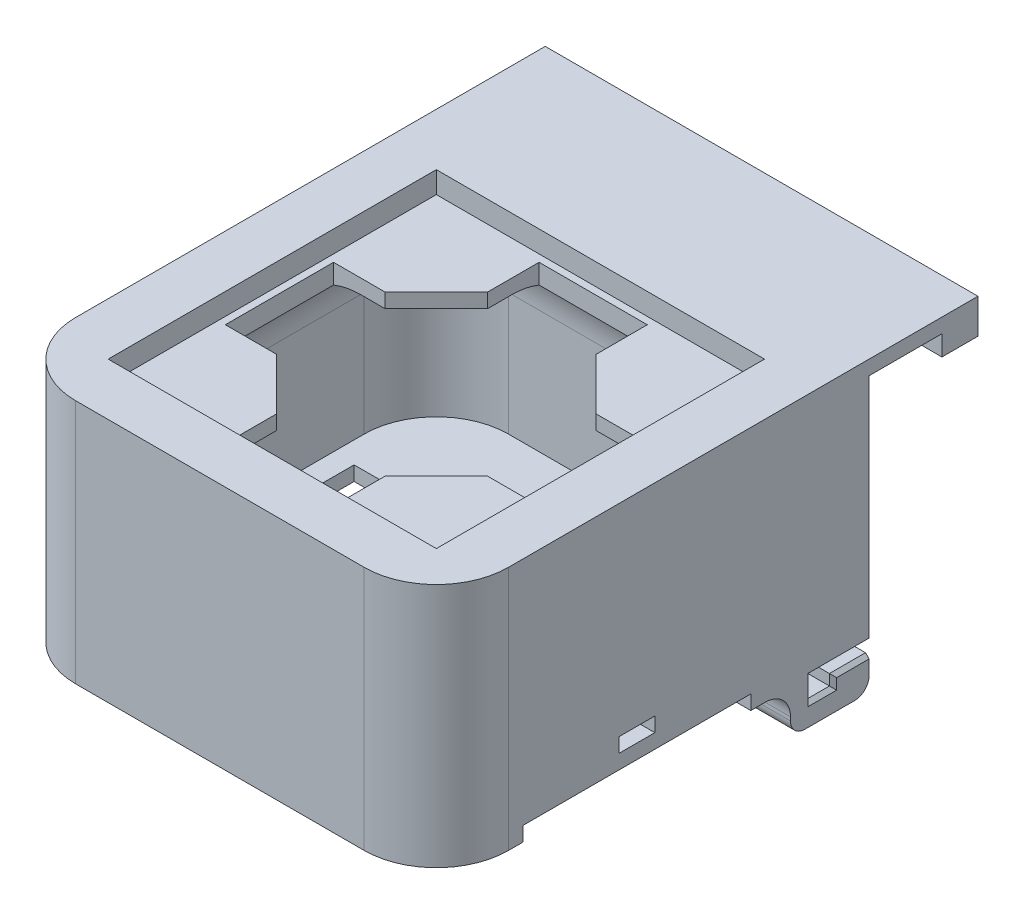
from build123d import *

# Parameters (mm, degrees)
BOSS_EXTRU_1_DEPTH       = 60
ESQUISSE4_W              = 45.5
ESQUISSE4_H              = 45.5
ENL_V_MAT_EXTRU_2_DEPTH  = 3
ENL_V_MAT_EXTRU_4_DEPTH  = 2
ENL_V_START              = -2
ESQUISSE5_W              = 56
ESQUISSE5_H              = 56
ENL_V_MAT_EXTRU_3_DEPTH  = 27
CONG_1_R                 = 10
CHANFREIN1_SIZE          = 0.5
ESQUISSE15_W             = 31.6
ESQUISSE15_H             = 2
ESQUISSE15_W_2           = 5
ENL_V_MAT_EXTRU_11_DEPTH = 55


with BuildPart() as part:
    # Esquisse1 → Boss.-Extru.1 (new body)
    with BuildSketch(Plane(origin=(0, 0, 0), x_dir=(0, 0, -1), z_dir=(1, 0, 0))):
        with BuildLine():
            Line((0, 0), (-8, 0))
            Line((-8, 0), (-8, -3))
            Line((-8, -3), (-5, -3))
            Line((-5, -3), (-5, -1.5))
            Line((-5, -1.5), (0, -1.5))
            Line((0, -1.5), (0, -4))
            ThreePointArc((0, -4), (-0.585786438, -5.414213562), (-2, -6))
            Line((-2, -6), (-8.9, -6))
            ThreePointArc((-8.9, -6), (-10.314213562, -5.414213562), (-10.9, -4))
            Line((-10.9, -4), (-10.9, -3.5))
            ThreePointArc((-10.9, -3.5), (-11.925126266, -1.025126266), (-14.4, 0))
            Line((-14.4, 0), (-60, 0))
            Line((-60, 0), (-60, 34))
            Line((-60, 34), (15.1, 34))
            Line((15.1, 34), (15.1, 29.2))
            Line((15.1, 29.2), (10.1, 29.2))
            Line((10.1, 29.2), (10.1, 32))
            Line((10.1, 32), (0, 32))
            Line((0, 32), (0, 0))
        make_face()
    extrude(amount=BOSS_EXTRU_1_DEPTH)

    # Esquisse4 → Enlèv. mat.-Extru.2 (cut)
    with BuildSketch(Plane(origin=(0, 34, 0), x_dir=(1, 0, 0), z_dir=(0, 1, 0))):
        with Locations((30, -30)):
            Rectangle(ESQUISSE4_W, ESQUISSE4_H)
    extrude(amount=-ENL_V_MAT_EXTRU_2_DEPTH, mode=Mode.SUBTRACT)

    # Esquisse6 → Enlèv. mat.-Extru.4 (cut)
    with BuildSketch(Plane(origin=(0, 31, 0), x_dir=(1, 0, 0), z_dir=(0, 1, 0))):
        Polygon((8.25, -22.5), (15.375, -22.5), (22.5, -15.375), (22.5, -8.25), (37.5, -8.25), (37.5, -15.375), (44.625, -22.5), (51.75, -22.5), (51.75, -37.5), (44.625, -37.5), (37.5, -44.625), (37.5, -51.75), (22.5, -51.75), (22.5, -44.625), (15.375, -37.5), (8.25, -37.5), align=None)
    extrude(amount=-ENL_V_MAT_EXTRU_4_DEPTH, mode=Mode.SUBTRACT)

    # Esquisse5 → Enlèv. mat.-Extru.3 (cut)
    with BuildSketch(Plane.XZ.offset(ENL_V_START)):
        with Locations((30, 30)):
            Rectangle(ESQUISSE5_W, ESQUISSE5_H)
    extrude(amount=-ENL_V_MAT_EXTRU_3_DEPTH, mode=Mode.SUBTRACT)

    # Congé1
    # the kernel refuses this fillet: 10 mm, written as the material it adds along each edge
    with BuildSketch(Plane(origin=(48, 19, 12), x_dir=(1, 0, 0), z_dir=(0, 1, 0))) as cong_1_piece_1_section:
        Polygon((0, 0), (CONG_1_R, 0), (CONG_1_R, CONG_1_R), (0, CONG_1_R), align=None)
    cong_1_piece_1 = extrude(amount=CONG_1_R, mode=Mode.PRIVATE)
    cong_1_piece_1 = cong_1_piece_1 - Plane(origin=(48, 19, 12), x_dir=(-0.7071067811865476, 0, 0.7071067811865475), z_dir=(0, 1, 0)) * Sphere(CONG_1_R, mode=Mode.PRIVATE)
    add(cong_1_piece_1)
    with BuildSketch(Plane(origin=(12, 19, 12), x_dir=(-1, 0, 0), z_dir=(0, 1, 0))) as cong_1_piece_2_section:
        Polygon((0, 0), (CONG_1_R, 0), (CONG_1_R, -CONG_1_R), (0, -CONG_1_R), align=None)
    cong_1_piece_2 = extrude(amount=CONG_1_R, mode=Mode.PRIVATE)
    cong_1_piece_2 = cong_1_piece_2 - Plane(origin=(12, 19, 12), x_dir=(0.7071067811865475, 0, 0.7071067811865477), z_dir=(0, 1, 0)) * Sphere(CONG_1_R, mode=Mode.PRIVATE)
    add(cong_1_piece_2)
    with BuildSketch(Plane(origin=(48, 19, 48), x_dir=(0, 0, 1), z_dir=(0, 1, 0))) as cong_1_piece_3_section:
        Polygon((0, 0), (CONG_1_R, 0), (CONG_1_R, CONG_1_R), (0, CONG_1_R), align=None)
    cong_1_piece_3 = extrude(amount=CONG_1_R, mode=Mode.PRIVATE)
    cong_1_piece_3 = cong_1_piece_3 - Plane(origin=(48, 19, 48), x_dir=(-0.7071067811865475, 0, -0.7071067811865477), z_dir=(0, 1, 0)) * Sphere(CONG_1_R, mode=Mode.PRIVATE)
    add(cong_1_piece_3)
    with BuildSketch(Plane(origin=(12, 19, 48), x_dir=(0, 0, 1), z_dir=(0, 1, 0))) as cong_1_piece_4_section:
        Polygon((0, 0), (CONG_1_R, 0), (CONG_1_R, -CONG_1_R), (0, -CONG_1_R), align=None)
    cong_1_piece_4 = extrude(amount=CONG_1_R, mode=Mode.PRIVATE)
    cong_1_piece_4 = cong_1_piece_4 - Plane(origin=(12, 19, 48), x_dir=(0.7071067811865476, 0, -0.7071067811865475), z_dir=(0, 1, 0)) * Sphere(CONG_1_R, mode=Mode.PRIVATE)
    add(cong_1_piece_4)
    with BuildSketch(Plane(origin=(48, 29, 2), x_dir=(0, 0, 1), z_dir=(-1, 0, 0))) as cong_1_piece_5_section:
        with BuildLine():
            CenterArc((CONG_1_R, -CONG_1_R), CONG_1_R, 90, 90)
            Line((0, -CONG_1_R), (0, 0))
            Line((0, 0), (CONG_1_R, 0))
        make_face()
    cong_1_piece_5 = extrude(amount=36, mode=Mode.PRIVATE)
    cong_1_piece_5 = split(cong_1_piece_5, bisect_by=Plane(origin=(37.5, 28.926962603, 9.610234862), z_dir=(1, 0, 0)), keep=Keep.TOP, mode=Mode.PRIVATE)
    cong_1_piece_5 = split(cong_1_piece_5, bisect_by=Plane(origin=(42.75, 28.926962603, 8.25), z_dir=(0, 0, 1)), keep=Keep.TOP, mode=Mode.PRIVATE)
    add(cong_1_piece_5)
    with BuildSketch(Plane(origin=(48, 29, 2), x_dir=(0, 0, 1), z_dir=(-1, 0, 0))) as cong_1_piece_6_section:
        with BuildLine():
            CenterArc((CONG_1_R, -CONG_1_R), CONG_1_R, 90, 90)
            Line((0, -CONG_1_R), (0, 0))
            Line((0, 0), (CONG_1_R, 0))
        make_face()
    cong_1_piece_6 = extrude(amount=36, mode=Mode.PRIVATE)
    cong_1_piece_6 = split(cong_1_piece_6, bisect_by=Plane(origin=(37.5, 26.584629987, 3.89445771), z_dir=(1, 0, 0)), keep=Keep.TOP, mode=Mode.PRIVATE)
    cong_1_piece_6 = split(cong_1_piece_6, bisect_by=Plane(origin=(42.75, 26.584629987, 8.25), z_dir=(0, 0, -1)), keep=Keep.TOP, mode=Mode.PRIVATE)
    add(cong_1_piece_6)
    with BuildSketch(Plane(origin=(48, 29, 2), x_dir=(0, 0, 1), z_dir=(-1, 0, 0))) as cong_1_piece_7_section:
        with BuildLine():
            CenterArc((CONG_1_R, -CONG_1_R), CONG_1_R, 90, 90)
            Line((0, -CONG_1_R), (0, 0))
            Line((0, 0), (CONG_1_R, 0))
        make_face()
    cong_1_piece_7 = extrude(amount=36, mode=Mode.PRIVATE)
    cong_1_piece_7 = split(cong_1_piece_7, bisect_by=Plane(origin=(37.5, 26.584629987, 3.89445771), z_dir=(-1, 0, 0)), keep=Keep.TOP, mode=Mode.PRIVATE)
    cong_1_piece_7 = split(cong_1_piece_7, bisect_by=Plane(origin=(30, 26.584629987, 8.25), z_dir=(0, 0, -1)), keep=Keep.TOP, mode=Mode.PRIVATE)
    cong_1_piece_7 = split(cong_1_piece_7, bisect_by=Plane(origin=(22.5, 26.584629987, 3.89445771), z_dir=(1, 0, 0)), keep=Keep.TOP, mode=Mode.PRIVATE)
    add(cong_1_piece_7)
    with BuildSketch(Plane(origin=(48, 29, 2), x_dir=(0, 0, 1), z_dir=(-1, 0, 0))) as cong_1_piece_8_section:
        with BuildLine():
            CenterArc((CONG_1_R, -CONG_1_R), CONG_1_R, 90, 90)
            Line((0, -CONG_1_R), (0, 0))
            Line((0, 0), (CONG_1_R, 0))
        make_face()
    cong_1_piece_8 = extrude(amount=36, mode=Mode.PRIVATE)
    cong_1_piece_8 = split(cong_1_piece_8, bisect_by=Plane(origin=(17.25, 28.926962603, 8.25), z_dir=(0, 0, 1)), keep=Keep.TOP, mode=Mode.PRIVATE)
    cong_1_piece_8 = split(cong_1_piece_8, bisect_by=Plane(origin=(22.5, 28.926962603, 9.610234862), z_dir=(-1, 0, 0)), keep=Keep.TOP, mode=Mode.PRIVATE)
    add(cong_1_piece_8)
    with BuildSketch(Plane(origin=(48, 29, 2), x_dir=(0, 0, 1), z_dir=(-1, 0, 0))) as cong_1_piece_9_section:
        with BuildLine():
            CenterArc((CONG_1_R, -CONG_1_R), CONG_1_R, 90, 90)
            Line((0, -CONG_1_R), (0, 0))
            Line((0, 0), (CONG_1_R, 0))
        make_face()
    cong_1_piece_9 = extrude(amount=36, mode=Mode.PRIVATE)
    cong_1_piece_9 = split(cong_1_piece_9, bisect_by=Plane(origin=(17.25, 26.584629987, 8.25), z_dir=(0, 0, -1)), keep=Keep.TOP, mode=Mode.PRIVATE)
    cong_1_piece_9 = split(cong_1_piece_9, bisect_by=Plane(origin=(22.5, 26.584629987, 3.89445771), z_dir=(-1, 0, 0)), keep=Keep.TOP, mode=Mode.PRIVATE)
    add(cong_1_piece_9)
    with BuildSketch(Plane(origin=(58, 29, 48), x_dir=(-1, 0, 0), z_dir=(0, 0, -1))) as cong_1_piece_10_section:
        with BuildLine():
            CenterArc((CONG_1_R, -CONG_1_R), CONG_1_R, 90, 90)
            Line((0, -CONG_1_R), (0, 0))
            Line((0, 0), (CONG_1_R, 0))
        make_face()
    cong_1_piece_10 = extrude(amount=36, mode=Mode.PRIVATE)
    cong_1_piece_10 = split(cong_1_piece_10, bisect_by=Plane(origin=(50.389765138, 28.926962603, 37.5), z_dir=(0, 0, 1)), keep=Keep.TOP, mode=Mode.PRIVATE)
    cong_1_piece_10 = split(cong_1_piece_10, bisect_by=Plane(origin=(51.75, 28.926962603, 42.75), z_dir=(-1, 0, 0)), keep=Keep.TOP, mode=Mode.PRIVATE)
    add(cong_1_piece_10)
    with BuildSketch(Plane(origin=(58, 29, 48), x_dir=(-1, 0, 0), z_dir=(0, 0, -1))) as cong_1_piece_11_section:
        with BuildLine():
            CenterArc((CONG_1_R, -CONG_1_R), CONG_1_R, 90, 90)
            Line((0, -CONG_1_R), (0, 0))
            Line((0, 0), (CONG_1_R, 0))
        make_face()
    cong_1_piece_11 = extrude(amount=36, mode=Mode.PRIVATE)
    cong_1_piece_11 = split(cong_1_piece_11, bisect_by=Plane(origin=(56.10554229, 26.584629987, 37.5), z_dir=(0, 0, 1)), keep=Keep.TOP, mode=Mode.PRIVATE)
    cong_1_piece_11 = split(cong_1_piece_11, bisect_by=Plane(origin=(51.75, 26.584629987, 42.75), z_dir=(1, 0, 0)), keep=Keep.TOP, mode=Mode.PRIVATE)
    add(cong_1_piece_11)
    with BuildSketch(Plane(origin=(58, 29, 48), x_dir=(-1, 0, 0), z_dir=(0, 0, -1))) as cong_1_piece_12_section:
        with BuildLine():
            CenterArc((CONG_1_R, -CONG_1_R), CONG_1_R, 90, 90)
            Line((0, -CONG_1_R), (0, 0))
            Line((0, 0), (CONG_1_R, 0))
        make_face()
    cong_1_piece_12 = extrude(amount=36, mode=Mode.PRIVATE)
    cong_1_piece_12 = split(cong_1_piece_12, bisect_by=Plane(origin=(56.10554229, 26.584629987, 37.5), z_dir=(0, 0, -1)), keep=Keep.TOP, mode=Mode.PRIVATE)
    cong_1_piece_12 = split(cong_1_piece_12, bisect_by=Plane(origin=(51.75, 26.584629987, 30), z_dir=(1, 0, 0)), keep=Keep.TOP, mode=Mode.PRIVATE)
    cong_1_piece_12 = split(cong_1_piece_12, bisect_by=Plane(origin=(56.10554229, 26.584629987, 22.5), z_dir=(0, 0, 1)), keep=Keep.TOP, mode=Mode.PRIVATE)
    add(cong_1_piece_12)
    with BuildSketch(Plane(origin=(58, 29, 48), x_dir=(-1, 0, 0), z_dir=(0, 0, -1))) as cong_1_piece_13_section:
        with BuildLine():
            CenterArc((CONG_1_R, -CONG_1_R), CONG_1_R, 90, 90)
            Line((0, -CONG_1_R), (0, 0))
            Line((0, 0), (CONG_1_R, 0))
        make_face()
    cong_1_piece_13 = extrude(amount=36, mode=Mode.PRIVATE)
    cong_1_piece_13 = split(cong_1_piece_13, bisect_by=Plane(origin=(51.75, 28.926962603, 17.25), z_dir=(-1, 0, 0)), keep=Keep.TOP, mode=Mode.PRIVATE)
    cong_1_piece_13 = split(cong_1_piece_13, bisect_by=Plane(origin=(50.389765138, 28.926962603, 22.5), z_dir=(0, 0, -1)), keep=Keep.TOP, mode=Mode.PRIVATE)
    add(cong_1_piece_13)
    with BuildSketch(Plane(origin=(58, 29, 48), x_dir=(-1, 0, 0), z_dir=(0, 0, -1))) as cong_1_piece_14_section:
        with BuildLine():
            CenterArc((CONG_1_R, -CONG_1_R), CONG_1_R, 90, 90)
            Line((0, -CONG_1_R), (0, 0))
            Line((0, 0), (CONG_1_R, 0))
        make_face()
    cong_1_piece_14 = extrude(amount=36, mode=Mode.PRIVATE)
    cong_1_piece_14 = split(cong_1_piece_14, bisect_by=Plane(origin=(51.75, 26.584629987, 17.25), z_dir=(1, 0, 0)), keep=Keep.TOP, mode=Mode.PRIVATE)
    cong_1_piece_14 = split(cong_1_piece_14, bisect_by=Plane(origin=(56.10554229, 26.584629987, 22.5), z_dir=(0, 0, -1)), keep=Keep.TOP, mode=Mode.PRIVATE)
    add(cong_1_piece_14)
    with BuildSketch(Plane(origin=(12, 29, 58), x_dir=(0, 0, -1), z_dir=(1, 0, 0))) as cong_1_piece_15_section:
        with BuildLine():
            CenterArc((CONG_1_R, -CONG_1_R), CONG_1_R, 90, 90)
            Line((0, -CONG_1_R), (0, 0))
            Line((0, 0), (CONG_1_R, 0))
        make_face()
    cong_1_piece_15 = extrude(amount=36, mode=Mode.PRIVATE)
    cong_1_piece_15 = split(cong_1_piece_15, bisect_by=Plane(origin=(22.5, 28.926962603, 50.389765138), z_dir=(-1, 0, 0)), keep=Keep.TOP, mode=Mode.PRIVATE)
    cong_1_piece_15 = split(cong_1_piece_15, bisect_by=Plane(origin=(17.25, 28.926962603, 51.75), z_dir=(0, 0, -1)), keep=Keep.TOP, mode=Mode.PRIVATE)
    add(cong_1_piece_15)
    with BuildSketch(Plane(origin=(12, 29, 58), x_dir=(0, 0, -1), z_dir=(1, 0, 0))) as cong_1_piece_16_section:
        with BuildLine():
            CenterArc((CONG_1_R, -CONG_1_R), CONG_1_R, 90, 90)
            Line((0, -CONG_1_R), (0, 0))
            Line((0, 0), (CONG_1_R, 0))
        make_face()
    cong_1_piece_16 = extrude(amount=36, mode=Mode.PRIVATE)
    cong_1_piece_16 = split(cong_1_piece_16, bisect_by=Plane(origin=(22.5, 26.584629987, 56.10554229), z_dir=(-1, 0, 0)), keep=Keep.TOP, mode=Mode.PRIVATE)
    cong_1_piece_16 = split(cong_1_piece_16, bisect_by=Plane(origin=(17.25, 26.584629987, 51.75), z_dir=(0, 0, 1)), keep=Keep.TOP, mode=Mode.PRIVATE)
    add(cong_1_piece_16)
    with BuildSketch(Plane(origin=(12, 29, 58), x_dir=(0, 0, -1), z_dir=(1, 0, 0))) as cong_1_piece_17_section:
        with BuildLine():
            CenterArc((CONG_1_R, -CONG_1_R), CONG_1_R, 90, 90)
            Line((0, -CONG_1_R), (0, 0))
            Line((0, 0), (CONG_1_R, 0))
        make_face()
    cong_1_piece_17 = extrude(amount=36, mode=Mode.PRIVATE)
    cong_1_piece_17 = split(cong_1_piece_17, bisect_by=Plane(origin=(22.5, 26.584629987, 56.10554229), z_dir=(1, 0, 0)), keep=Keep.TOP, mode=Mode.PRIVATE)
    cong_1_piece_17 = split(cong_1_piece_17, bisect_by=Plane(origin=(30, 26.584629987, 51.75), z_dir=(0, 0, 1)), keep=Keep.TOP, mode=Mode.PRIVATE)
    cong_1_piece_17 = split(cong_1_piece_17, bisect_by=Plane(origin=(37.5, 26.584629987, 56.10554229), z_dir=(-1, 0, 0)), keep=Keep.TOP, mode=Mode.PRIVATE)
    add(cong_1_piece_17)
    with BuildSketch(Plane(origin=(12, 29, 58), x_dir=(0, 0, -1), z_dir=(1, 0, 0))) as cong_1_piece_18_section:
        with BuildLine():
            CenterArc((CONG_1_R, -CONG_1_R), CONG_1_R, 90, 90)
            Line((0, -CONG_1_R), (0, 0))
            Line((0, 0), (CONG_1_R, 0))
        make_face()
    cong_1_piece_18 = extrude(amount=36, mode=Mode.PRIVATE)
    cong_1_piece_18 = split(cong_1_piece_18, bisect_by=Plane(origin=(42.75, 28.926962603, 51.75), z_dir=(0, 0, -1)), keep=Keep.TOP, mode=Mode.PRIVATE)
    cong_1_piece_18 = split(cong_1_piece_18, bisect_by=Plane(origin=(37.5, 28.926962603, 50.389765138), z_dir=(1, 0, 0)), keep=Keep.TOP, mode=Mode.PRIVATE)
    add(cong_1_piece_18)
    with BuildSketch(Plane(origin=(12, 29, 58), x_dir=(0, 0, -1), z_dir=(1, 0, 0))) as cong_1_piece_19_section:
        with BuildLine():
            CenterArc((CONG_1_R, -CONG_1_R), CONG_1_R, 90, 90)
            Line((0, -CONG_1_R), (0, 0))
            Line((0, 0), (CONG_1_R, 0))
        make_face()
    cong_1_piece_19 = extrude(amount=36, mode=Mode.PRIVATE)
    cong_1_piece_19 = split(cong_1_piece_19, bisect_by=Plane(origin=(42.75, 26.584629987, 51.75), z_dir=(0, 0, 1)), keep=Keep.TOP, mode=Mode.PRIVATE)
    cong_1_piece_19 = split(cong_1_piece_19, bisect_by=Plane(origin=(37.5, 26.584629987, 56.10554229), z_dir=(1, 0, 0)), keep=Keep.TOP, mode=Mode.PRIVATE)
    add(cong_1_piece_19)
    with BuildSketch(Plane(origin=(2, 29, 12), x_dir=(1, 0, 0), z_dir=(0, 0, 1))) as cong_1_piece_20_section:
        with BuildLine():
            CenterArc((CONG_1_R, -CONG_1_R), CONG_1_R, 90, 90)
            Line((0, -CONG_1_R), (0, 0))
            Line((0, 0), (CONG_1_R, 0))
        make_face()
    cong_1_piece_20 = extrude(amount=36, mode=Mode.PRIVATE)
    cong_1_piece_20 = split(cong_1_piece_20, bisect_by=Plane(origin=(8.25, 28.926962603, 17.25), z_dir=(1, 0, 0)), keep=Keep.TOP, mode=Mode.PRIVATE)
    cong_1_piece_20 = split(cong_1_piece_20, bisect_by=Plane(origin=(9.610234862, 28.926962603, 22.5), z_dir=(0, 0, -1)), keep=Keep.TOP, mode=Mode.PRIVATE)
    add(cong_1_piece_20)
    with BuildSketch(Plane(origin=(2, 29, 12), x_dir=(1, 0, 0), z_dir=(0, 0, 1))) as cong_1_piece_21_section:
        with BuildLine():
            CenterArc((CONG_1_R, -CONG_1_R), CONG_1_R, 90, 90)
            Line((0, -CONG_1_R), (0, 0))
            Line((0, 0), (CONG_1_R, 0))
        make_face()
    cong_1_piece_21 = extrude(amount=36, mode=Mode.PRIVATE)
    cong_1_piece_21 = split(cong_1_piece_21, bisect_by=Plane(origin=(8.25, 26.584629987, 17.25), z_dir=(-1, 0, 0)), keep=Keep.TOP, mode=Mode.PRIVATE)
    cong_1_piece_21 = split(cong_1_piece_21, bisect_by=Plane(origin=(3.89445771, 26.584629987, 22.5), z_dir=(0, 0, -1)), keep=Keep.TOP, mode=Mode.PRIVATE)
    add(cong_1_piece_21)
    with BuildSketch(Plane(origin=(2, 29, 12), x_dir=(1, 0, 0), z_dir=(0, 0, 1))) as cong_1_piece_22_section:
        with BuildLine():
            CenterArc((CONG_1_R, -CONG_1_R), CONG_1_R, 90, 90)
            Line((0, -CONG_1_R), (0, 0))
            Line((0, 0), (CONG_1_R, 0))
        make_face()
    cong_1_piece_22 = extrude(amount=36, mode=Mode.PRIVATE)
    cong_1_piece_22 = split(cong_1_piece_22, bisect_by=Plane(origin=(8.25, 26.584629987, 30), z_dir=(-1, 0, 0)), keep=Keep.TOP, mode=Mode.PRIVATE)
    cong_1_piece_22 = split(cong_1_piece_22, bisect_by=Plane(origin=(3.89445771, 26.584629987, 37.5), z_dir=(0, 0, -1)), keep=Keep.TOP, mode=Mode.PRIVATE)
    cong_1_piece_22 = split(cong_1_piece_22, bisect_by=Plane(origin=(3.89445771, 26.584629987, 22.5), z_dir=(0, 0, 1)), keep=Keep.TOP, mode=Mode.PRIVATE)
    add(cong_1_piece_22)
    with BuildSketch(Plane(origin=(2, 29, 12), x_dir=(1, 0, 0), z_dir=(0, 0, 1))) as cong_1_piece_23_section:
        with BuildLine():
            CenterArc((CONG_1_R, -CONG_1_R), CONG_1_R, 90, 90)
            Line((0, -CONG_1_R), (0, 0))
            Line((0, 0), (CONG_1_R, 0))
        make_face()
    cong_1_piece_23 = extrude(amount=36, mode=Mode.PRIVATE)
    cong_1_piece_23 = split(cong_1_piece_23, bisect_by=Plane(origin=(8.25, 28.926962603, 42.75), z_dir=(1, 0, 0)), keep=Keep.TOP, mode=Mode.PRIVATE)
    cong_1_piece_23 = split(cong_1_piece_23, bisect_by=Plane(origin=(9.610234862, 28.926962603, 37.5), z_dir=(0, 0, 1)), keep=Keep.TOP, mode=Mode.PRIVATE)
    add(cong_1_piece_23)
    with BuildSketch(Plane(origin=(2, 29, 12), x_dir=(1, 0, 0), z_dir=(0, 0, 1))) as cong_1_piece_24_section:
        with BuildLine():
            CenterArc((CONG_1_R, -CONG_1_R), CONG_1_R, 90, 90)
            Line((0, -CONG_1_R), (0, 0))
            Line((0, 0), (CONG_1_R, 0))
        make_face()
    cong_1_piece_24 = extrude(amount=36, mode=Mode.PRIVATE)
    cong_1_piece_24 = split(cong_1_piece_24, bisect_by=Plane(origin=(8.25, 26.584629987, 42.75), z_dir=(-1, 0, 0)), keep=Keep.TOP, mode=Mode.PRIVATE)
    cong_1_piece_24 = split(cong_1_piece_24, bisect_by=Plane(origin=(3.89445771, 26.584629987, 37.5), z_dir=(0, 0, 1)), keep=Keep.TOP, mode=Mode.PRIVATE)
    add(cong_1_piece_24)
    with BuildSketch(Plane(origin=(58, 2, 58), x_dir=(-1, 0, 0), z_dir=(0, 1, 0)), Plane(origin=(58, 2, 2), x_dir=(0, 0, 1), z_dir=(0, 1, 0))) as cong_1_piece_25:
        with BuildLine():
            CenterArc((CONG_1_R, -CONG_1_R), CONG_1_R, 90, 90)
            Line((0, -CONG_1_R), (0, 0))
            Line((0, 0), (CONG_1_R, 0))
        make_face()
    extrude(amount=17)
    with BuildSketch(Plane(origin=(2, 2, 2), x_dir=(0, 0, 1), z_dir=(0, 1, 0)), Plane(origin=(2, 2, 58), x_dir=(1, 0, 0), z_dir=(0, 1, 0))) as cong_1_piece_26:
        with BuildLine():
            CenterArc((CONG_1_R, CONG_1_R), CONG_1_R, 180, 90)
            Line((0, CONG_1_R), (0, 0))
            Line((0, 0), (CONG_1_R, 0))
        make_face()
    extrude(amount=17)
    # the kernel refuses this fillet: 10 mm, written as the material it takes off along each edge
    with BuildSketch(Plane(origin=(60, -25, 60), x_dir=(0, 0, -1), z_dir=(0, 1, 0)), Plane(origin=(0, -25, 60), x_dir=(1, 0, 0), z_dir=(0, 1, 0))) as cong_1_2_piece_1:
        with BuildLine():
            CenterArc((CONG_1_R, CONG_1_R), CONG_1_R, 180, 90)
            Line((0, CONG_1_R), (0, 0))
            Line((0, 0), (CONG_1_R, 0))
        make_face()
    extrude(amount=84, mode=Mode.SUBTRACT)

    # Chanfrein1
    chanfrein1_edges = [part.edges().sort_by_distance(p)[0] for p in [
        (60, -1.5, 2.5),
        (60, -2.25, 5),
        (60, -3, 6.5),
        (60, -1.5, 8),
        (60, 0, 4),
    ]]
    chamfer(chanfrein1_edges, length=CHANFREIN1_SIZE)

    # Esquisse15 → Enlèv. mat.-Extru.11 (cut)
    with BuildSketch(Plane(origin=(60, 0, 0), x_dir=(0, 0, -1), z_dir=(1, 0, 0))):
        with Locations((-32.2, 1)):
            Rectangle(ESQUISSE15_W, ESQUISSE15_H)
        with Locations((-32.2, 5)):
            Rectangle(ESQUISSE15_W_2, ESQUISSE15_H)
    extrude(amount=-ENL_V_MAT_EXTRU_11_DEPTH, mode=Mode.SUBTRACT)


solid = part.part
